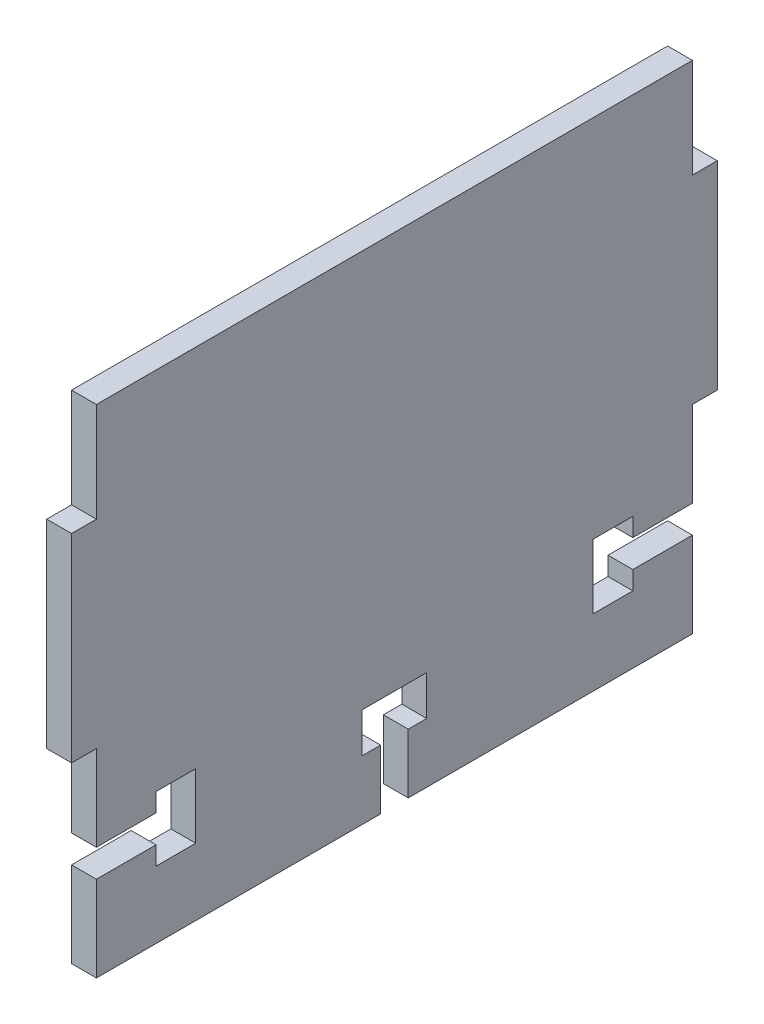
from build123d import *

# Parameters (mm, degrees)
BOSS_EXTRUDE1_DEPTH = 3.175


with BuildPart() as part:
    # Sketch1 → Boss-Extrude1 (new body)
    with BuildSketch(Plane(origin=(0, 0, 0), x_dir=(0, 0, -1), z_dir=(1, 0, 0))):
        Polygon((-4.1275, -19.05), (4.1275, -19.05), (4.1275, -24.13), (1.7653, -24.13), (1.7653, -31.75), (10.9347, -31.75), (14.4653, -31.75), (38.1, -31.75), (38.1, -20.8153), (30.48, -20.8153), (30.48, -23.1775), (25.4, -23.1775), (25.4, -14.9225), (30.48, -14.9225), (30.48, -17.2847), (38.1, -17.2847), (38.1, -6.35), (41.275, -6.35), (41.275, 19.05), (38.1, 19.05), (38.1, 31.75), (-38.1, 31.75), (-38.1, 19.05), (-41.275, 19.05), (-41.275, -6.35), (-38.1, -6.35), (-38.1, -17.2847), (-30.48, -17.2847), (-30.48, -14.9225), (-25.4, -14.9225), (-25.4, -23.1775), (-30.48, -23.1775), (-30.48, -20.8153), (-38.1, -20.8153), (-38.1, -31.75), (-1.7653, -31.75), (-1.7653, -24.13), (-4.1275, -24.13), align=None)
    extrude(amount=BOSS_EXTRUDE1_DEPTH)


solid = part.part
